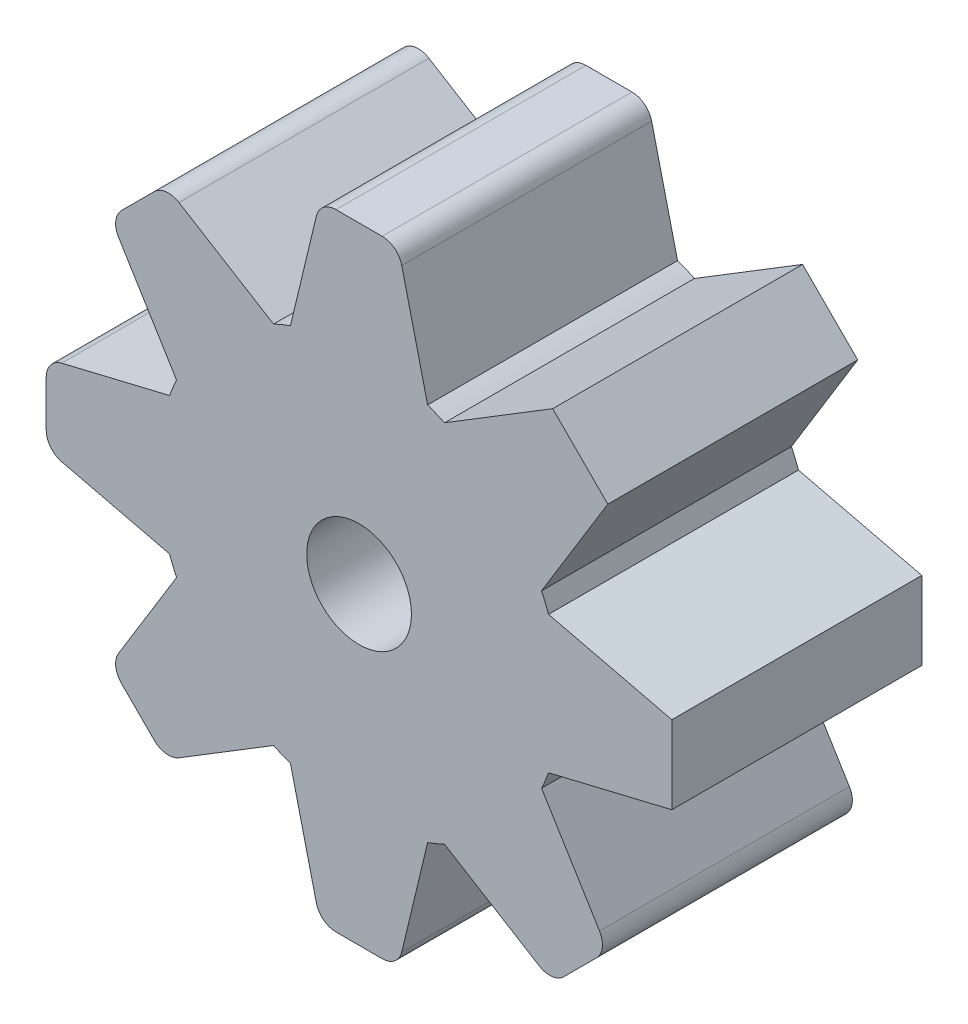
from build123d import *

# Parameters (mm, degrees)
SKETCH1_R                      = 10
SKETCH1_R_2                    = 2.6
BOSS_EXTRUDE1_DEPTH            = 12.4
BOSS_EXTRUDE2_DEPTH            = 6.2
CIRPATTERN1_DEPTH              = 12.4
CUT_EXTRUDE1_REACH             = 35.782
CUT_EXTRUDE1_END_RADIUS        = 2.6
SKETCH5_R                      = 1.5
CUT_EXTRUDE1_DIRECTION_2_DEPTH = 4.1
FILLET4_R                      = 1


# Read off the part's stored shape, not the designer's step: CirPattern1
with BuildPart() as part:
    # Sketch1 → Boss-Extrude1 (new body)
    with BuildSketch(Plane.XY):
        with Locations(Location((0, 0, 0), (0, 0, 180))):
            Circle(SKETCH1_R)
        with Locations(Location((0, 0, 0), (0, 0, 180))):
            Circle(SKETCH1_R_2, mode=Mode.SUBTRACT)
    extrude(amount=BOSS_EXTRUDE1_DEPTH)

    # Sketch2 → Boss-Extrude2 (add, symmetric)
    with BuildSketch(Plane.XY.offset(6.2)):
        Polygon((-1.935099749, 15.52158862), (-3.5, 9), (3.5, 9), (1.935099749, 15.52158862), align=None)
    extrude(amount=BOSS_EXTRUDE2_DEPTH, both=True)

    # CirPattern1 outline → CirPattern1 (add)
    with BuildSketch(Plane.XY):
        with BuildLine():
            Line((-9.607098413, 12.343742723), (-12.343742723, 9.607098413))
            Line((-12.343742723, 9.607098413), (-9.055455951, 4.242489544))
            ThreePointArc((-9.055455951, 4.242489544), (-7.071067812, 7.071067812), (-4.242489544, 9.055455951))
            Line((-4.242489544, 9.055455951), (-9.607098413, 12.343742723))
        make_face()
        with BuildLine():
            ThreePointArc((4.242489544, 9.055455951), (7.071067812, 7.071067812), (9.055455951, 4.242489544))
            Line((9.055455951, 4.242489544), (12.343742723, 9.607098413))
            Line((12.343742723, 9.607098413), (9.607098413, 12.343742723))
            Line((9.607098413, 12.343742723), (4.242489544, 9.055455951))
        make_face()
        with BuildLine():
            ThreePointArc((9.403067435, 3.403281184), (10, 0), (9.403067435, -3.403281184))
            Line((9.403067435, -3.403281184), (15.52158862, -1.935099749))
            Line((15.52158862, -1.935099749), (15.52158862, 1.935099749))
            Line((15.52158862, 1.935099749), (9.403067435, 3.403281184))
        make_face()
        with BuildLine():
            ThreePointArc((9.055455951, -4.242489544), (7.071067812, -7.071067812), (4.242489544, -9.05545595))
            Line((4.242489544, -9.05545595), (9.607098413, -12.343742723))
            Line((9.607098413, -12.343742723), (12.343742723, -9.607098413))
            Line((12.343742723, -9.607098413), (9.055455951, -4.242489544))
        make_face()
        with BuildLine():
            ThreePointArc((3.403281184, -9.403067435), (0, -10), (-3.403281184, -9.403067435))
            Line((-3.403281184, -9.403067435), (-1.935099749, -15.52158862))
            Line((-1.935099749, -15.52158862), (1.935099749, -15.52158862))
            Line((1.935099749, -15.52158862), (3.403281184, -9.403067435))
        make_face()
        with BuildLine():
            ThreePointArc((-4.242489544, -9.05545595), (-7.071067812, -7.071067812), (-9.055455951, -4.242489544))
            Line((-9.055455951, -4.242489544), (-12.343742723, -9.607098413))
            Line((-12.343742723, -9.607098413), (-9.607098413, -12.343742723))
            Line((-9.607098413, -12.343742723), (-4.242489544, -9.05545595))
        make_face()
        with BuildLine():
            ThreePointArc((-9.403067435, -3.403281184), (-10, 0), (-9.403067435, 3.403281184))
            Line((-9.403067435, 3.403281184), (-15.52158862, 1.935099749))
            Line((-15.52158862, 1.935099749), (-15.52158862, -1.935099749))
            Line((-15.52158862, -1.935099749), (-9.403067435, -3.403281184))
        make_face()
    extrude(amount=CIRPATTERN1_DEPTH)

    # Cut-Extrude1: up to this cylinder (the profile starts outside it)
    cut_extrude1_end = Plane(origin=(0, 0, 6.2), z_dir=(0, 0, -1)) * Cylinder(CUT_EXTRUDE1_END_RADIUS, 77.764, mode=Mode.PRIVATE)
    # Sketch5 → Cut-Extrude1 (cut, up to the surface)
    with BuildSketch(Plane(origin=(-3.826834324, 9.238795325, 0), x_dir=(0.9238795325112892, 0.3826834323650838, 0), z_dir=(-0.3826834323650838, 0.9238795325112892, 0)), mode=Mode.PRIVATE) as cut_extrude1_sk1:
        with Locations(Location((0, -6.2, 0), (0, 0, 72.37509472))):
            Circle(SKETCH5_R)
    cut_extrude1_tool1 = extrude(cut_extrude1_sk1.sketch, amount=-CUT_EXTRUDE1_REACH, mode=Mode.PRIVATE) - cut_extrude1_end
    add(cut_extrude1_tool1.solids().sort_by_distance((-3.826834, 9.238795, 6.2))[0], mode=Mode.SUBTRACT)

    # Sketch5 → Cut-Extrude1 direction 2 (cut)
    with BuildSketch(Plane(origin=(-3.826834324, 9.238795325, 0), x_dir=(0.9238795325112892, 0.3826834323650838, 0), z_dir=(-0.3826834323650838, 0.9238795325112892, 0))):
        with Locations(Location((0, -6.2, 0), (0, 0, 72.37509472))):
            Circle(SKETCH5_R)
    extrude(amount=CUT_EXTRUDE1_DIRECTION_2_DEPTH, mode=Mode.SUBTRACT)

    # Fillet4
    fillet4_edges = [part.edges().sort_by_distance(p)[0] for p in [
        (9.607098413, -12.343742723, 6.2),
        (12.343742723, -9.607098413, 6.2),
        (1.935099749, 15.52158862, 6.2),
        (-1.935099749, 15.52158862, 6.2),
        (-9.607098413, 12.343742723, 6.2),
        (-12.343742723, 9.607098413, 6.2),
        (-15.52158862, 1.935099749, 6.2),
        (-15.52158862, -1.935099749, 6.2),
        (-12.343742723, -9.607098413, 6.2),
        (-9.607098413, -12.343742723, 6.2),
        (-1.935099749, -15.52158862, 6.2),
        (1.935099749, -15.52158862, 6.2),
    ]]
    fillet(fillet4_edges, radius=FILLET4_R)


solid = part.part
